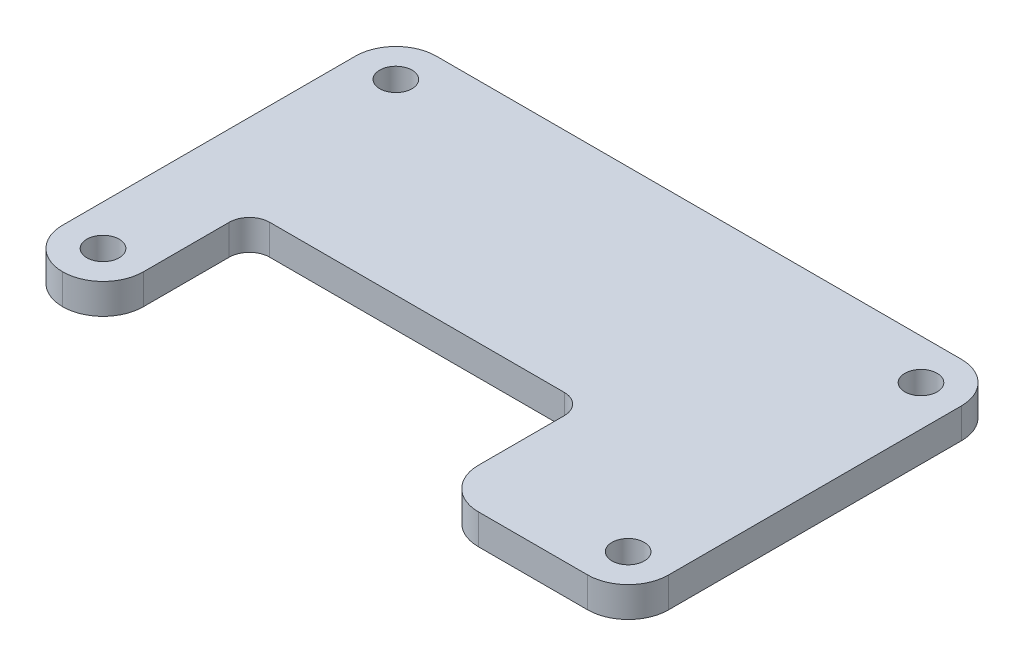
from build123d import *

# Parameters (mm, degrees)
SKETCH1_W           = 60
SKETCH1_H           = 37
BOSS_EXTRUDE1_DEPTH = 2.9972
FILLET1_R           = 4
SKETCH2_R           = 1.6
CUT_EXTRUDE1_DEPTH  = 36.372774952
SKETCH3_W           = 33.176
SKETCH3_H           = 14.5
CUT_EXTRUDE2_DEPTH  = 36.372774952
FILLET2_R           = 4
FILLET3_R           = 2


with BuildPart() as part:
    # Sketch1 → Boss-Extrude1 (new body)
    with BuildSketch(Plane(origin=(0, 0, 0), x_dir=(1, 0, 0), z_dir=(0, 1, 0))):
        Rectangle(SKETCH1_W, SKETCH1_H)
    extrude(amount=BOSS_EXTRUDE1_DEPTH)

    # Fillet1
    fillet1_edges = [part.edges().sort_by_distance(p)[0] for p in [
        (30, 1.4986, 18.5),
        (-30, 1.4986, 18.5),
        (-30, 1.4986, -18.5),
        (30, 1.4986, -18.5),
    ]]
    fillet(fillet1_edges, radius=FILLET1_R)

    # Sketch2 → Cut-Extrude1 (cut, through all)
    with BuildSketch(Plane(origin=(0, 2.9972, 0), x_dir=(1, 0, 0), z_dir=(0, 1, 0))):
        with Locations(Location((-26, 14.5, 0), (0, 0, 270))):
            Circle(SKETCH2_R)
        with Locations(Location((-26, -14.5, 0), (0, 0, 270))):
            Circle(SKETCH2_R)
        with Locations(Location((26, -14.5, 0), (0, 0, 270))):
            Circle(SKETCH2_R)
        with Locations(Location((26, 14.5, 0), (0, 0, 270))):
            Circle(SKETCH2_R)
    extrude(amount=-CUT_EXTRUDE1_DEPTH, mode=Mode.SUBTRACT)

    # Sketch3 → Cut-Extrude2 (cut, through all)
    with BuildSketch(Plane(origin=(0, 2.9972, 0), x_dir=(1, 0, 0), z_dir=(0, 1, 0))):
        with Locations((-5.412, -11.25)):
            Rectangle(SKETCH3_W, SKETCH3_H)
    extrude(amount=-CUT_EXTRUDE2_DEPTH, mode=Mode.SUBTRACT)

    # Fillet2
    fillet2_edges = [part.edges().sort_by_distance(p)[0] for p in [
        (11.176, 1.4986, 18.5),
        (-22, 1.4986, 18.5),
    ]]
    fillet(fillet2_edges, radius=FILLET2_R - 0.0001)  # a hair under: the kernel refuses the full size

    # Fillet3
    fillet3_edges = [part.edges().sort_by_distance(p)[0] for p in [
        (11.176, 1.4986, 4),
        (-22, 1.4986, 4),
    ]]
    fillet(fillet3_edges, radius=FILLET3_R)


solid = part.part
